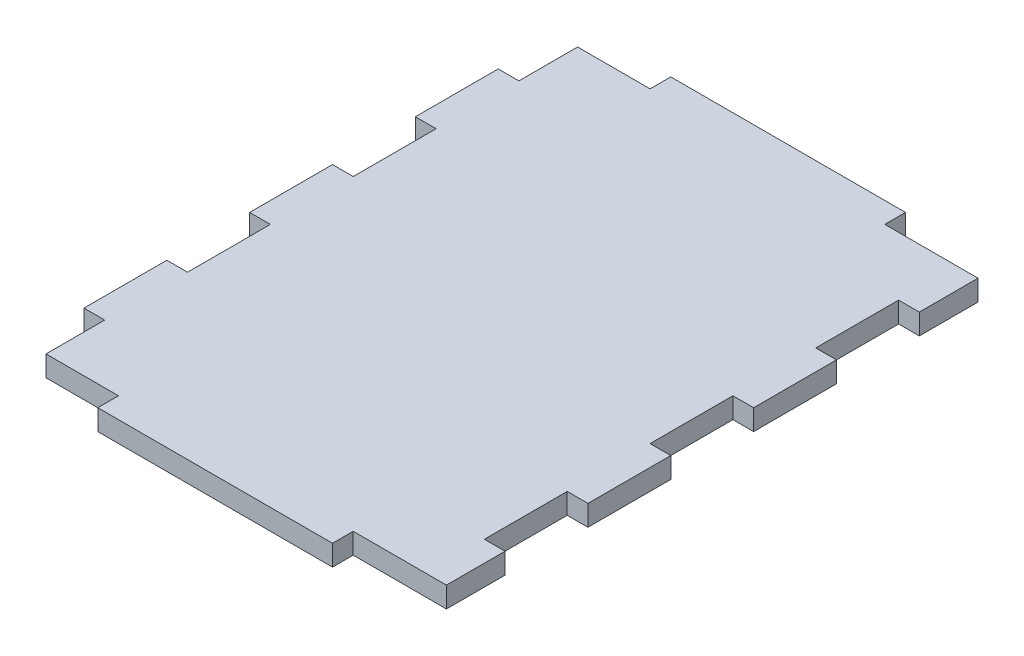
from build123d import *

# Parameters (mm, degrees)
SALIENTE_EXTRUIR1_DEPTH = 3


with BuildPart() as part:
    # Croquis1 → Saliente-Extruir1 (new body)
    with BuildSketch(Plane(origin=(0, 0, 0), x_dir=(1, 0, 0), z_dir=(0, 1, 0))):
        Polygon((13.5, 3), (13.5, 0), (30.5, 0), (47.5, 0), (47.5, 3), (61, 3), (61, 11.5), (58, 11.5), (58, 23.5), (61, 23.5), (61, 35.5), (58, 35.5), (58, 47.5), (61, 47.5), (61, 59.5), (58, 59.5), (58, 71.5), (61, 71.5), (61, 80), (47.5, 80), (47.5, 83), (13.5, 83), (13.5, 80), (3, 80), (3, 71.5), (0, 71.5), (0, 59.5), (3, 59.5), (3, 47.5), (0, 47.5), (0, 35.5), (3, 35.5), (3, 23.5), (0, 23.5), (0, 11.5), (3, 11.5), (3, 3), align=None)
    extrude(amount=SALIENTE_EXTRUIR1_DEPTH)


solid = part.part
